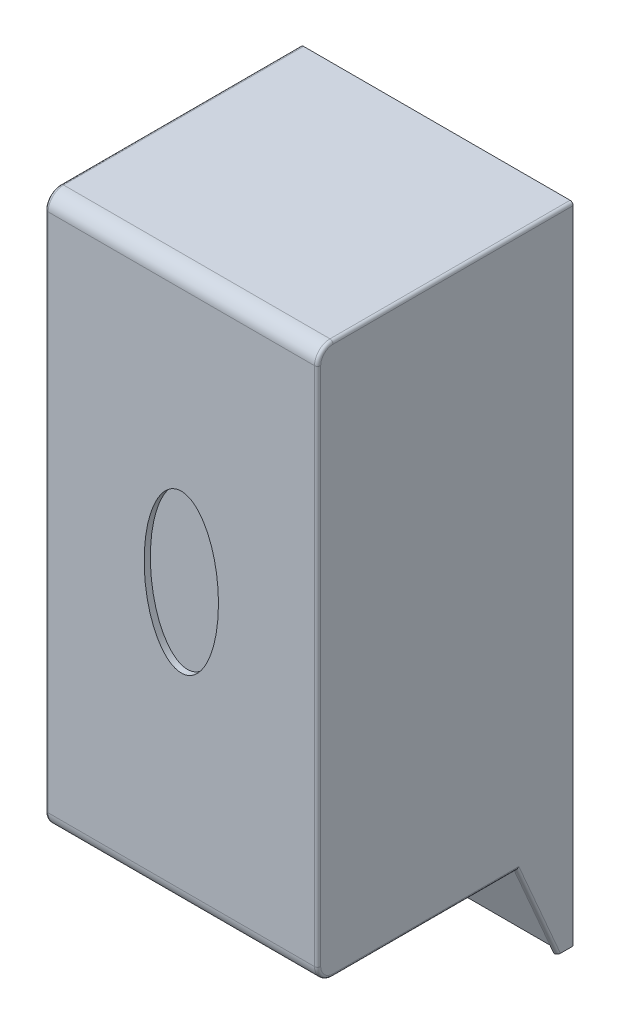
from build123d import *

# Parameters (mm, degrees)
SKETCH1_W           = 111.76
SKETCH1_H           = 264.16
BOSS_EXTRUDE1_DEPTH = 104.77499999999999
SKETCH2_W           = 111.76
SKETCH2_H           = 38.1
CUT_EXTRUDE1_DEPTH  = 81.66099999999999
CUT_LOFT3_START     = -22
CUT_LOFT3_OUTLINE_W = 111.76
CUT_LOFT3_OUTLINE_H = 41.526476030000005
CUT_LOFT3_DEPTH     = 15.94808629
SKETCH7_W           = 109.22000000000003
SKETCH7_H           = 3.7934503700089675
CUT_EXTRUDE3_DEPTH  = 306.36634363498547
SKETCH8_RX          = 32.28826667150602
SKETCH8_RY          = 15.237159552845547
CUT_EXTRUDE4_DEPTH  = 2.54
SKETCH9_R           = 5.040527571520393
BOSS_EXTRUDE2_DEPTH = 6.35
SKETCH10_R          = 2.398168465987588
BOSS_EXTRUDE3_DEPTH = 2.54
FILLET1_R           = 6.35
FILLET2_R           = 1.27


with BuildPart() as part:
    # Sketch1 → Boss-Extrude1 (new body)
    with BuildSketch(Plane.XY):
        with Locations((55.88, 132.08)):
            Rectangle(SKETCH1_W, SKETCH1_H)
    extrude(amount=BOSS_EXTRUDE1_DEPTH)

    # Sketch2 → Cut-Extrude1 (cut)
    with BuildSketch(Plane.XY.offset(104.77499999999999)):
        with Locations((55.88, 19.05)):
            Rectangle(SKETCH2_W, SKETCH2_H)
    extrude(amount=-CUT_EXTRUDE1_DEPTH, mode=Mode.SUBTRACT)

    # Cut-Loft3: read off the stored shape, not the designer's step
    # Cut-Loft3 outline → Cut-Loft3 (cut)
    with BuildSketch(Plane(origin=(0, 0, 0), x_dir=(1, 0, 0), z_dir=(0, 0.3977658725333551, -0.9174869539387353)).offset(CUT_LOFT3_START)):
        with Locations((55.88, -23.386975308)):
            Rectangle(CUT_LOFT3_OUTLINE_W, CUT_LOFT3_OUTLINE_H)
    extrude(amount=CUT_LOFT3_DEPTH, mode=Mode.SUBTRACT)

    # Sketch7 → Cut-Extrude3 (cut, through all)
    with BuildSketch(Plane(origin=(0, 0, 0), x_dir=(-1, 0, 0), z_dir=(0, 0, -1))):
        with Locations((-55.88000000000001, 1.8967251850044837)):
            Rectangle(SKETCH7_W, SKETCH7_H)
    extrude(amount=-CUT_EXTRUDE3_DEPTH, mode=Mode.SUBTRACT)

    # Sketch8 → Cut-Extrude4 (cut)
    with BuildSketch(Plane.XY.offset(104.77499999999999)):
        with Locations(Location((55.88, 153.6634760331982), (0, 0, 90))):
            Ellipse(SKETCH8_RX, SKETCH8_RY)
    extrude(amount=-CUT_EXTRUDE4_DEPTH, mode=Mode.SUBTRACT)

    # Sketch9 → Boss-Extrude2 (add)
    with BuildSketch(Plane.XZ.offset(-38.1)):
        with Locations(Location((55.88, 64.40266714831378, 0), (0, 0, 90))):
            Circle(SKETCH9_R)
    extrude(amount=BOSS_EXTRUDE2_DEPTH)

    # Sketch10 → Boss-Extrude3 (add)
    with BuildSketch(Plane.XZ.offset(-31.75)):
        with Locations(Location((55.88, 64.40266714831378, 0), (0, 0, 270))):
            Circle(SKETCH10_R)
    extrude(amount=BOSS_EXTRUDE3_DEPTH)

    # Fillet1
    fillet1_edges = [part.edges().sort_by_distance(p)[0] for p in [
        (55.88, 264.16, 104.77499999999999),
        (55.88, 38.1, 104.77499999999999),
    ]]
    fillet(fillet1_edges, radius=FILLET1_R)

    # Fillet2
    fillet2_edges = [part.edges().sort_by_distance(p)[0] for p in [
        (0, 264.16, 49.2125),
        (0, 262.3001280605346, 102.91512806053457),
        (0, 38.1, 60.7695),
        (0, 39.959871939465415, 102.91512806053457),
        (111.76, 38.1, 60.7695),
        (111.76, 39.959871939465415, 102.91512806053457),
        (111.76, 264.16, 49.2125),
        (111.76, 262.3001280605346, 102.91512806053457),
        (0, 19.049999999822614, 14.855092514590622),
        (111.76, 19.04999999982261, 14.85509251459062),
        (0, 151.13, 104.77499999999999),
        (111.76, 151.13, 104.77499999999999),
    ]]
    fillet(fillet2_edges, radius=FILLET2_R)


solid = part.part
